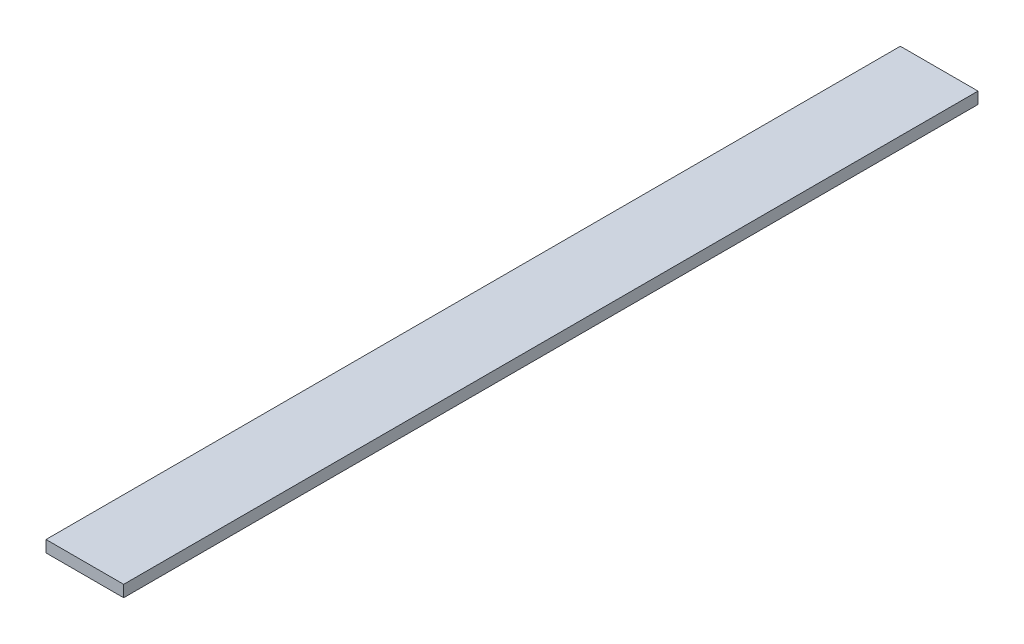
from build123d import *

# Parameters (mm, degrees)
SKETCH_1_W      = 20
SKETCH_1_H      = 220
EXTRUDE_1_DEPTH = 3


with BuildPart() as part:
    # Sketch 1 → Бобышка-Вытянуть1 (new body)
    with BuildSketch(Plane(origin=(0, 0, 0), x_dir=(1, 0, 0), z_dir=(0, 1, 0))):
        Rectangle(SKETCH_1_W, SKETCH_1_H)
    extrude(amount=EXTRUDE_1_DEPTH)


solid = part.part
